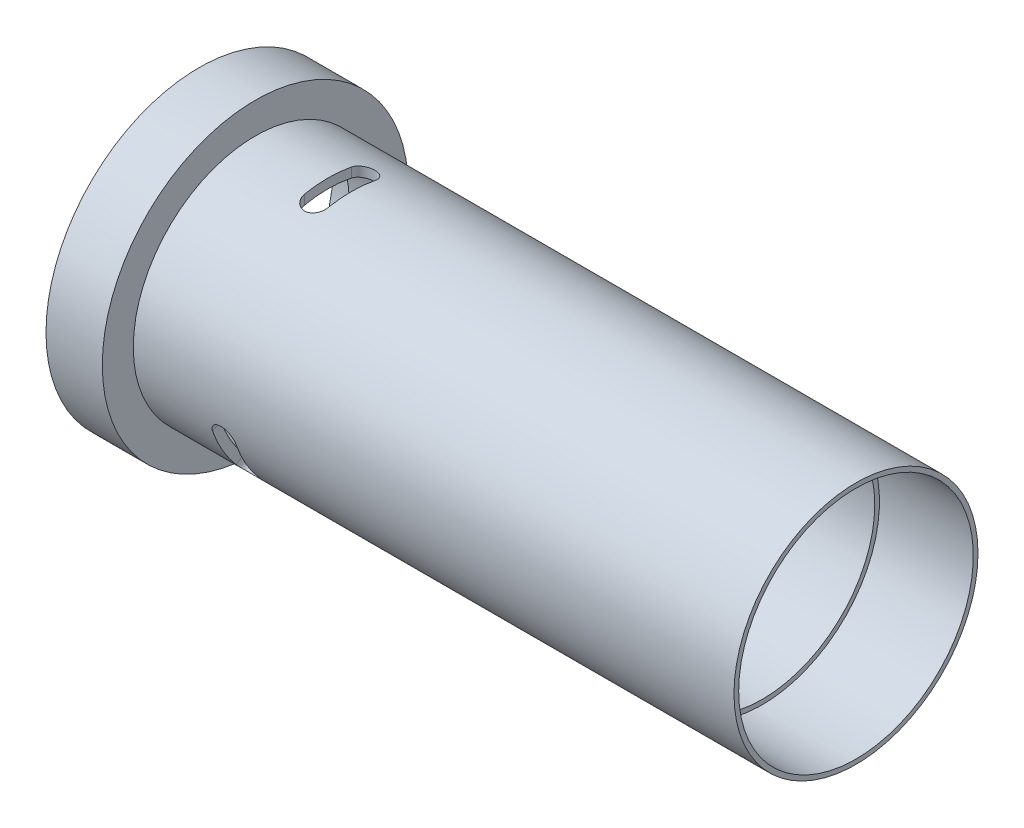
from build123d import *

# Parameters (mm, degrees)
CUT_EXTRUDE1_DEPTH = 5.08
CIRPATTERN1_COUNT  = 3


# Read off the part's stored shape, not the designer's step: Revolve1
with BuildPart() as part:
    # Revolve1 outline → Revolve1 (revolve)
    with BuildSketch(Plane.YX):
        Polygon((20.701, 0), (20.701, 7.62), (16.51, 7.62), (16.51, 88.9), (15.875, 88.9), (15.875, 76.2), (15.24, 76.2), (15.24, 5.08), (18.161, 5.08), (18.161, 0), align=None)
    revolve(axis=Axis((0, 0, 0), (1, 0, 0)))

    # Sketch2 → Cut-Extrude1 (cut)
    with BuildSketch(Plane(origin=(0, 16.51, 0), x_dir=(1, 0, 0), z_dir=(0, 1, 0))):
        with BuildLine():
            Line((20.6375, 3.175), (20.6375, -3.175))
            ThreePointArc((20.6375, -3.175), (19.05, -4.7625), (17.4625, -3.175))
            Line((17.4625, -3.175), (17.4625, 3.175))
            ThreePointArc((17.4625, 3.175), (19.05, 4.7625), (20.6375, 3.175))
        make_face()
    cut_extrude1 = extrude(amount=-CUT_EXTRUDE1_DEPTH, mode=Mode.SUBTRACT)

    # CirPattern1: Cut-Extrude1 ×3 about axis
    cirpattern1_axis = Axis((0, 0, 0), (1, 0, 0))
    for i in range(1, CIRPATTERN1_COUNT):
        add(cut_extrude1.rotate(cirpattern1_axis, i * 360 / CIRPATTERN1_COUNT), mode=Mode.SUBTRACT)


solid = part.part
